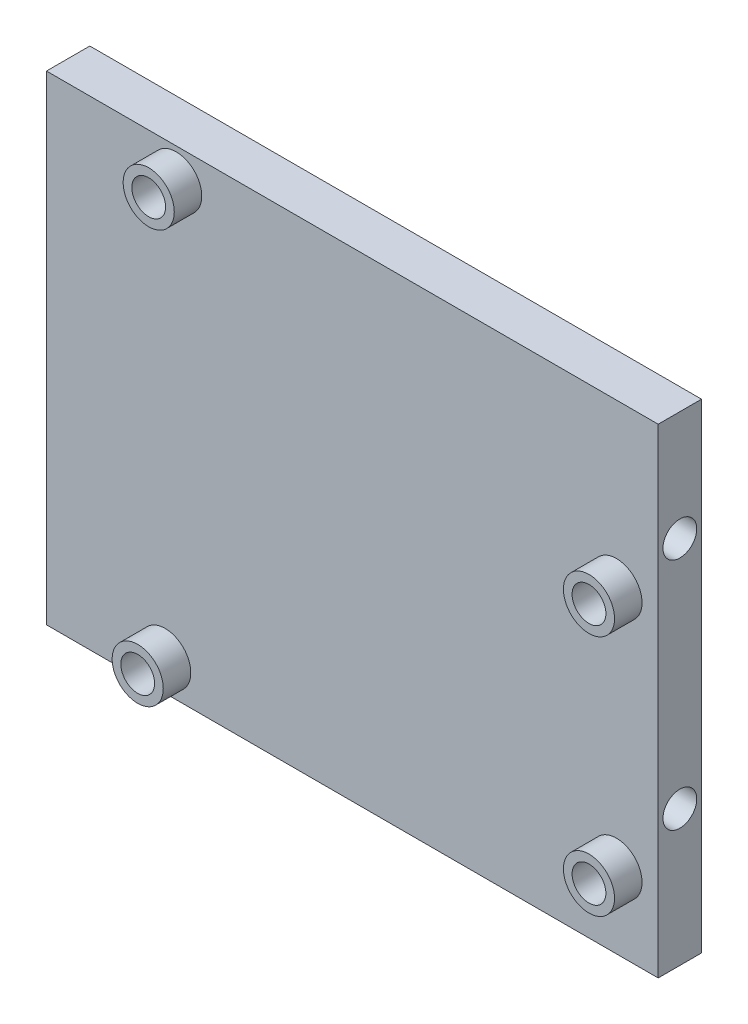
from build123d import *

# Parameters (mm, degrees)
SKETCH1_W           = 70.58
SKETCH1_H           = 55.34
SKETCH1_R           = 1.95
BOSS_EXTRUDE1_DEPTH = 2.5
SKETCH3_R           = 2.95
SKETCH3_R_2         = 1.95
BOSS_EXTRUDE2_DEPTH = 3.175
SKETCH4_R           = 1.95
CUT_EXTRUDE2_DEPTH  = 5.5


with BuildPart() as part:
    # Sketch1 → Boss-Extrude1 (new, symmetric)
    with BuildSketch(Plane.XY):
        Rectangle(SKETCH1_W, SKETCH1_H)
        with Locations((-20.32, 24.13)):
            Circle(SKETCH1_R, mode=Mode.SUBTRACT)
        with Locations((30.48, 8.89)):
            Circle(SKETCH1_R, mode=Mode.SUBTRACT)
        with Locations((30.48, -19.05)):
            Circle(SKETCH1_R, mode=Mode.SUBTRACT)
        with Locations((-21.59, -24.13)):
            Circle(SKETCH1_R, mode=Mode.SUBTRACT)
    extrude(amount=BOSS_EXTRUDE1_DEPTH, both=True)

    # Sketch3 → Boss-Extrude2 (add)
    # profile 1 of 4: a face of its own
    with BuildSketch(Plane.XY.offset(2.5)):
        with Locations((-20.32, 24.13)):
            Circle(SKETCH3_R)
        with Locations((-20.32, 24.13)):
            Circle(SKETCH3_R_2, mode=Mode.SUBTRACT)
    # profile 2 of 4: a face of its own
    with BuildSketch(Plane.XY.offset(2.5)):
        with Locations((-21.59, -24.13)):
            Circle(SKETCH3_R)
        with Locations((-21.59, -24.13)):
            Circle(SKETCH3_R_2, mode=Mode.SUBTRACT)
    # profile 3 of 4: a face of its own
    with BuildSketch(Plane.XY.offset(2.5)):
        with Locations((30.48, 8.89)):
            Circle(SKETCH3_R)
        with Locations((30.48, 8.89)):
            Circle(SKETCH3_R_2, mode=Mode.SUBTRACT)
    # profile 4 of 4: a face of its own
    with BuildSketch(Plane.XY.offset(2.5)):
        with Locations((30.48, -19.05)):
            Circle(SKETCH3_R)
        with Locations((30.48, -19.05)):
            Circle(SKETCH3_R_2, mode=Mode.SUBTRACT)
    extrude(amount=BOSS_EXTRUDE2_DEPTH)

    # Sketch4 → Cut-Extrude2 (cut)
    with BuildSketch(Plane(origin=(35.29, 0, 0), x_dir=(0, 0, -1), z_dir=(1, 0, 0))):
        with Locations((0, 15)):
            Circle(SKETCH4_R)
        with Locations((0, -12)):
            Circle(SKETCH4_R)
    extrude(amount=-CUT_EXTRUDE2_DEPTH, mode=Mode.SUBTRACT)


solid = part.part
